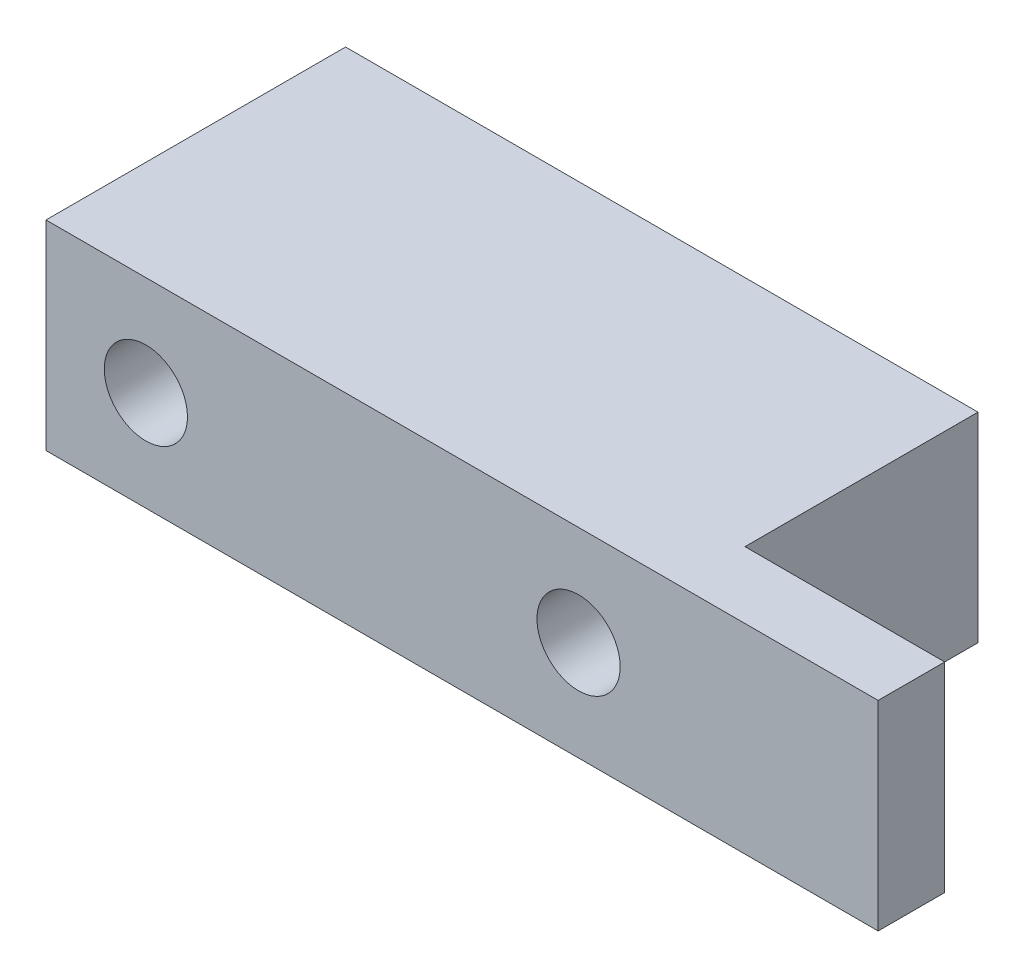
from build123d import *

# Parameters (mm, degrees)
SKETCH1_W           = 6
SKETCH1_H           = 19
SKETCH1_R           = 1.25
BOSS_EXTRUDE1_DEPTH = 9
SKETCH2_W           = 6
SKETCH2_H           = 2
BOSS_EXTRUDE2_DEPTH = 6


with BuildPart() as part:
    # Sketch1 → Boss-Extrude1 (new body)
    with BuildSketch(Plane(origin=(0, 0, 0), x_dir=(0, 1, 0), z_dir=(0, 0, 1))):
        Rectangle(SKETCH1_W, SKETCH1_H)
        with Locations((0, 6.5)):
            Circle(SKETCH1_R, mode=Mode.SUBTRACT)
        with Locations((0, -6.5)):
            Circle(SKETCH1_R, mode=Mode.SUBTRACT)
    extrude(amount=BOSS_EXTRUDE1_DEPTH)

    # Sketch2 → Boss-Extrude2 (add)
    with BuildSketch(Plane.YZ.offset(9.5)):
        with Locations((0, 8)):
            Rectangle(SKETCH2_W, SKETCH2_H)
    extrude(amount=BOSS_EXTRUDE2_DEPTH)


solid = part.part
